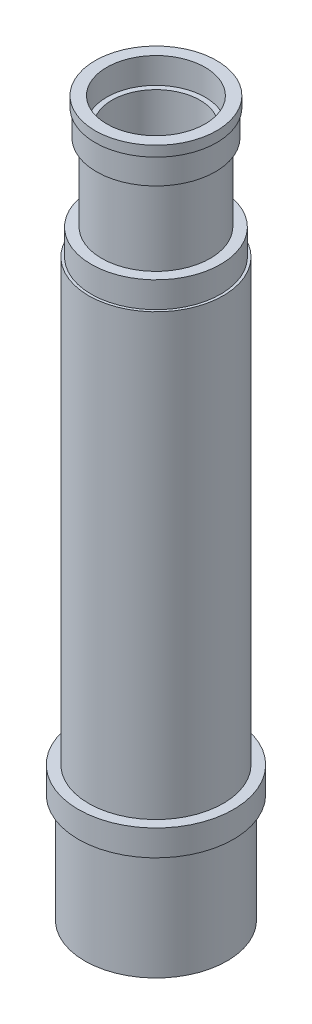
from build123d import *

# Parameters (mm, degrees)
PARTIR1_START         = -61.583819077
PARTIR1_OUTLINE_R     = 13.75
PARTIR1_OUTLINE_R_2   = 11.75
PARTIR1_DEPTH         = 23
PARTIR1_START_2       = -40.583819077
PARTIR1_2_OUTLINE_R   = 15
PARTIR1_2_OUTLINE_R_2 = 13
PARTIR1_2_DEPTH       = 5
PARTIR1_START_3       = -37.583819077
PARTIR1_3_OUTLINE_R   = 13
PARTIR1_3_OUTLINE_R_2 = 11
PARTIR1_3_DEPTH       = 2
PARTIR1_4_OUTLINE_R   = 15
PARTIR1_4_OUTLINE_R_2 = 10.5
PARTIR1_4_DEPTH       = 111
PARTIR1_START_4       = -35.583819077
PARTIR1_5_OUTLINE_R   = 13
PARTIR1_5_OUTLINE_R_2 = 11
PARTIR1_5_DEPTH       = 85
PARTIR1_START_5       = 47.416180923
PARTIR1_6_OUTLINE_R   = 11
PARTIR1_6_OUTLINE_R_2 = 10.5
PARTIR1_6_DEPTH       = 2


# Read off the part's stored shape, not the designer's step: Partir1
with BuildPart() as part:
    # Croquis1 → Revolución1 (revolve)
    with BuildSketch(Plane.XY, mode=Mode.PRIVATE) as revoluci_n1_sk:
        Polygon((11.75, -61.583819077), (13.75, -61.583819077), (13.75, -40.583819077), (15, -40.583819077), (15, -35.583819077), (13, -35.583819077), (13, 49.416180923), (12.5, 49.416180923), (12.5, 54.416180923), (10.5, 54.416180923), (10.5, 69.416180923), (11.5, 69.416180923), (11.5, 74.416180923), (11.75, 74.416180923), (11.75, 76.416180923), (9.5, 76.416180923), (9.5, 71.416180923), (8.5, 71.416180923), (8.5, 52.416180923), (10.5, 52.416180923), (10.5, 47.416180923), (11, 47.416180923), (11, -37.583819077), (13, -37.583819077), (13, -38.583819077), (11.75, -38.583819077), (11.75, -59.583819077), align=None)
    revolve(revoluci_n1_sk.sketch.rotate(Axis((0, 74.416180923, 0), (0, -1, 0)), 90), axis=Axis((0, 74.416180923, 0), (0, -1, 0)))

    # Partir1 4 outline → Partir1 4 (cut)
    with BuildSketch(Plane(origin=(0, 0, 0), x_dir=(1, 0, 0), z_dir=(0, 1, 0)).offset(PARTIR1_START)):
        Circle(PARTIR1_4_OUTLINE_R)
        Circle(PARTIR1_4_OUTLINE_R_2, mode=Mode.SUBTRACT)
    extrude(amount=PARTIR1_4_DEPTH, mode=Mode.SUBTRACT)


with BuildPart() as body_2:
    # Partir1 outline → Partir1 (new body)
    with BuildSketch(Plane(origin=(0, 0, 0), x_dir=(1, 0, 0), z_dir=(0, 1, 0)).offset(PARTIR1_START)):
        Circle(PARTIR1_OUTLINE_R)
        Circle(PARTIR1_OUTLINE_R_2, mode=Mode.SUBTRACT)
    extrude(amount=PARTIR1_DEPTH)

    # Partir1 2 outline → Partir1 2 (add)
    with BuildSketch(Plane(origin=(0, 0, 0), x_dir=(1, 0, 0), z_dir=(0, 1, 0)).offset(PARTIR1_START_2)):
        Circle(PARTIR1_2_OUTLINE_R)
        Circle(PARTIR1_2_OUTLINE_R_2, mode=Mode.SUBTRACT)
    extrude(amount=PARTIR1_2_DEPTH)

    # Partir1 3 outline → Partir1 3 (add)
    with BuildSketch(Plane(origin=(0, 0, 0), x_dir=(1, 0, 0), z_dir=(0, 1, 0)).offset(PARTIR1_START_3)):
        Circle(PARTIR1_3_OUTLINE_R)
        Circle(PARTIR1_3_OUTLINE_R_2, mode=Mode.SUBTRACT)
    extrude(amount=PARTIR1_3_DEPTH)


with BuildPart() as body_3:
    # Partir1 5 outline → Partir1 5 (new body)
    with BuildSketch(Plane(origin=(0, 0, 0), x_dir=(1, 0, 0), z_dir=(0, 1, 0)).offset(PARTIR1_START_4)):
        Circle(PARTIR1_5_OUTLINE_R)
        Circle(PARTIR1_5_OUTLINE_R_2, mode=Mode.SUBTRACT)
    extrude(amount=PARTIR1_5_DEPTH)

    # Partir1 6 outline → Partir1 6 (add)
    with BuildSketch(Plane(origin=(0, 0, 0), x_dir=(1, 0, 0), z_dir=(0, 1, 0)).offset(PARTIR1_START_5)):
        Circle(PARTIR1_6_OUTLINE_R)
        Circle(PARTIR1_6_OUTLINE_R_2, mode=Mode.SUBTRACT)
    extrude(amount=PARTIR1_6_DEPTH)


solid = Compound([part.part, body_2.part, body_3.part])
